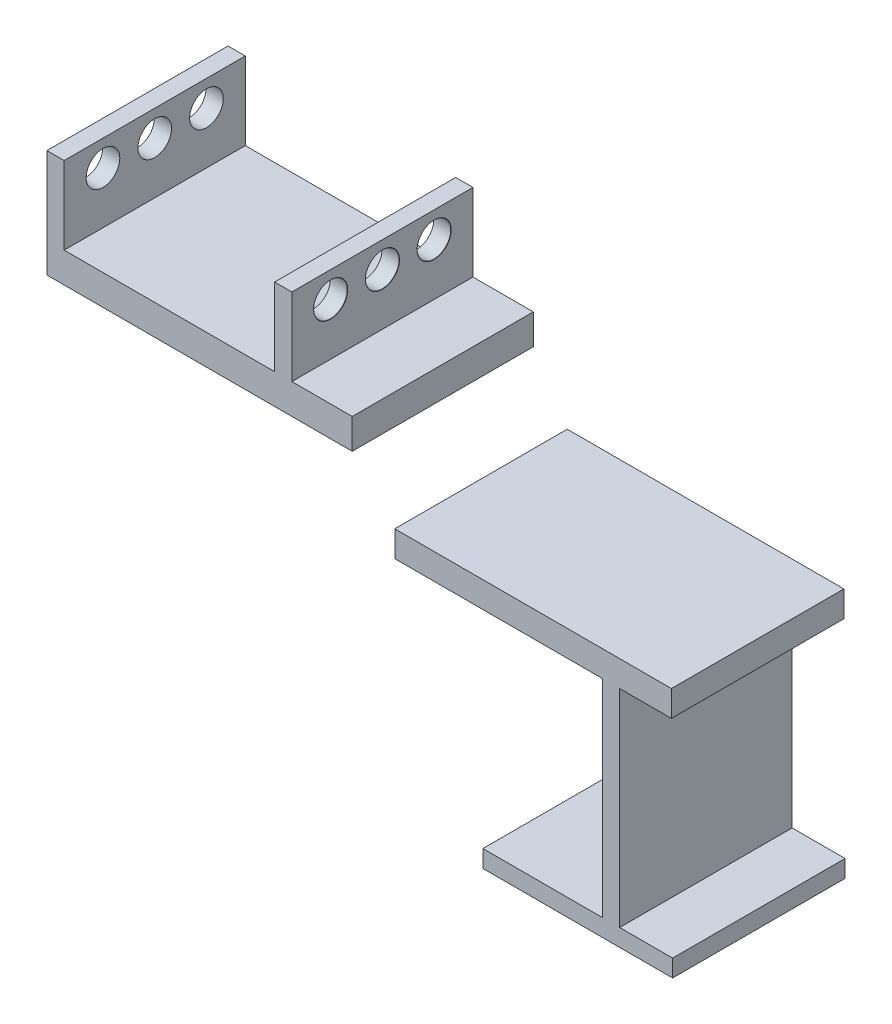
from build123d import *

# Parameters (mm, degrees)
BOSS_EXTRUDE1_DEPTH              = 21
M3_5_CLEARANCE_HOLE1_D           = 3.9
M3_5_CLEARANCE_HOLE1_CSINK_D     = 3.95
M3_5_CLEARANCE_HOLE1_CSINK_ANGLE = 90
BOSS_EXTRUDE2_DEPTH              = 20


with BuildPart() as part:
    # Sketch1 → Boss-Extrude1 (new body)
    with BuildSketch(Plane.XY):
        Polygon((14.42095576, -30), (21.42095576, -30), (21.42095576, -33.5), (14.42095576, -33.5), (-13.97904424, -33.5), (-13.97904424, -21), (-11.97904424, -21), (-11.97904424, -30), (12.42095576, -30), (12.42095576, -21), (14.42095576, -21), align=None)
    extrude(amount=-BOSS_EXTRUDE1_DEPTH)

    # M3.5 Clearance Hole1 (through all)
    with Locations(Plane(origin=(14.42095576, 0, 0), x_dir=(0, 0, -1), z_dir=(1, 0, 0))):
        with Locations((4.5, -24), (10.5, -24), (16.5, -24)):
            CounterSinkHole(M3_5_CLEARANCE_HOLE1_D / 2, M3_5_CLEARANCE_HOLE1_CSINK_D / 2, counter_sink_angle=M3_5_CLEARANCE_HOLE1_CSINK_ANGLE)


with BuildPart() as body_2:
    # Sketch8 → Boss-Extrude2 (new body)
    with BuildSketch(Plane.XY):
        Polygon((78.570560517, -47.813718268), (56.570560517, -47.813718268), (56.570560517, -45.813718268), (70.43179602, -45.813718268), (70.43179602, -21.813718268), (46.353970621, -21.813718268), (46.353970621, -18.813718268), (78.43179602, -18.813718268), (78.43179602, -21.813718268), (72.43179602, -21.813718268), (72.43179602, -45.813718268), (78.570560517, -45.813718268), align=None)
    extrude(amount=BOSS_EXTRUDE2_DEPTH)


solid = Compound([part.part, body_2.part])
